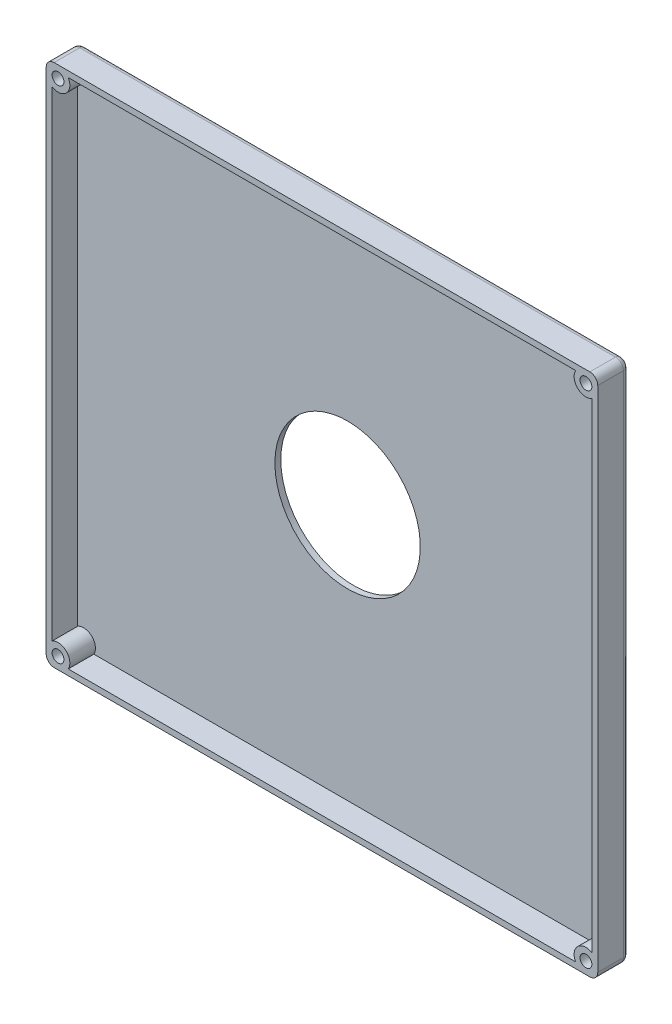
from build123d import *

# Parameters (mm, degrees)
SKETCH1_W                = 140
SKETCH1_H                = 133
BOSS_EXTRUDE1_DEPTH      = 8
F_3_0_3_DIAMETER_HOLE1_D = 3
SHELL3_T                 = -1.5
FILLET2_R                = 2
FILLET3_R                = 2
FILLET4_R                = 2
FILLET5_R                = 2
SKETCH13_R               = 18.454910332
CUT_EXTRUDE1_DEPTH       = 10
FILLET6_R                = 1.5


with BuildPart() as part:
    # Sketch1 → Boss-Extrude1 (new body)
    with BuildSketch(Plane.XY):
        Rectangle(SKETCH1_W, SKETCH1_H)
    extrude(amount=BOSS_EXTRUDE1_DEPTH)

    # Ø3.0 (3) Diameter Hole1 (through all)
    with Locations(Plane.XY.offset(8)):
        with Locations((-67, 63.5), (67, 63.5), (-67, -63.5), (67, -63.5)):
            Hole(F_3_0_3_DIAMETER_HOLE1_D / 2)

    # Shell3
    shell3_openings = [part.faces().sort_by_distance(p)[0] for p in [
        (0, 0, 8),
    ]]
    offset(amount=SHELL3_T, openings=shell3_openings)

    # Fillet2
    fillet2_edges = [part.edges().sort_by_distance(p)[0] for p in [
        (-70, 66.5, 4),
    ]]
    fillet(fillet2_edges, radius=FILLET2_R)

    # Fillet3
    fillet3_edges = [part.edges().sort_by_distance(p)[0] for p in [
        (-70, -66.5, 4),
    ]]
    fillet(fillet3_edges, radius=FILLET3_R)

    # Fillet4
    fillet4_edges = [part.edges().sort_by_distance(p)[0] for p in [
        (70, -66.5, 4),
    ]]
    fillet(fillet4_edges, radius=FILLET4_R)

    # Fillet5
    fillet5_edges = [part.edges().sort_by_distance(p)[0] for p in [
        (70, 66.5, 4),
    ]]
    fillet(fillet5_edges, radius=FILLET5_R)

    # Sketch13 → Cut-Extrude1 (cut)
    with BuildSketch(Plane(origin=(0, 0, 0), x_dir=(-1, 0, 0), z_dir=(0, 0, -1))):
        Circle(SKETCH13_R)
    extrude(amount=-CUT_EXTRUDE1_DEPTH, mode=Mode.SUBTRACT)

    # Fillet6
    fillet6_edges = [part.edges().sort_by_distance(p)[0] for p in [
        (-70, 0, 0),
        (-69.414213562, 65.914213562, 0),
        (0, -66.5, 0),
        (-69.414213562, -65.914213562, 0),
        (70, 0, 0),
        (69.414213562, -65.914213562, 0),
        (0, 66.5, 0),
        (69.414213562, 65.914213562, 0),
    ]]
    fillet(fillet6_edges, radius=FILLET6_R - 0.0001)  # a hair under: the kernel refuses the full size


solid = part.part
